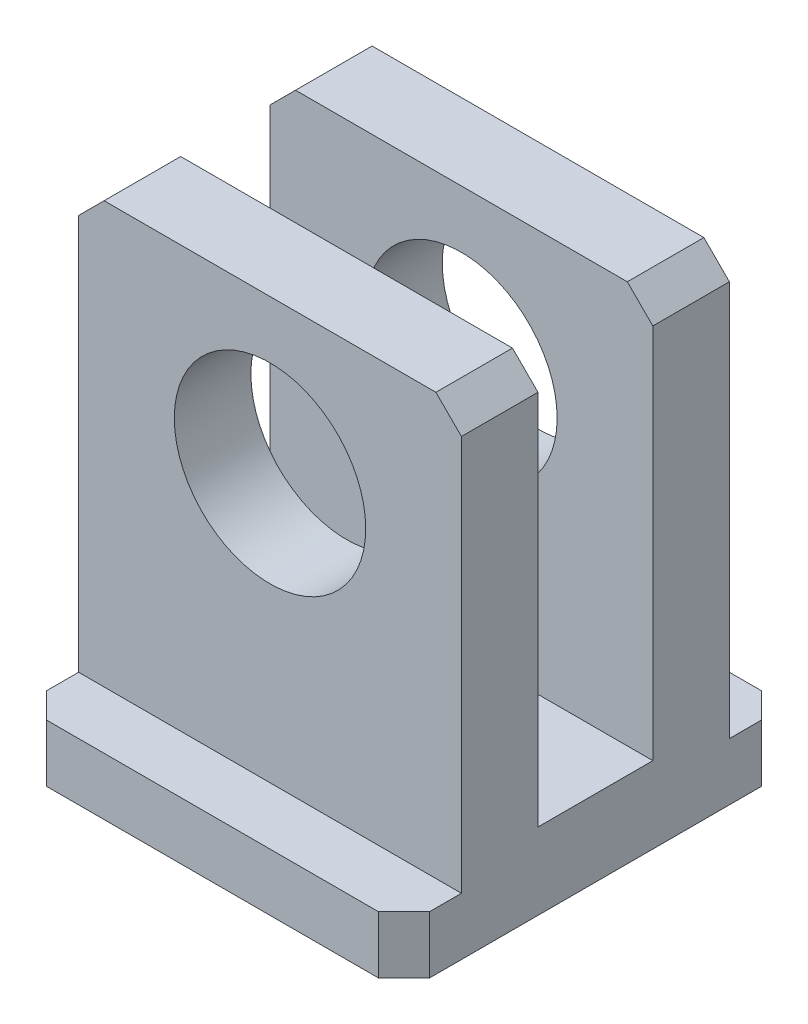
from build123d import *

# Parameters (mm, degrees)
EXTRUDE_1_DEPTH            = 6
SKETCH_8_W                 = 30
SKETCH_8_H                 = 4.5
EXTRUDE_4_DEPTH            = 4.5
CHAMFER_1_SIZE             = 2
CHAMFER_2_SIZE             = 2
CUT_EXTRUDE_2_REACH        = 26.75
SKETCH_8_5_R               = 7.5
SKETCH_13_W                = 30
SKETCH_13_H                = 6
EXTRUDE_5_DEPTH            = 4.5
CHAMFER_1_OF_MIRROR_4_SIZE = 2
CHAMFER_2_OF_MIRROR_4_SIZE = 2


with BuildPart() as part:
    # 草图1 → 凸台-拉伸1 (new body)
    with BuildSketch(Plane.XY):
        Polygon((-13, 18.75), (-15, 16.75), (-15, -18.75), (15, -18.75), (15, 16.75), (13, 18.75), align=None)
    extrude_1 = extrude(amount=EXTRUDE_1_DEPTH)

    # 草图8 → 凸台-拉伸4 (add)
    with BuildSketch(Plane.XY.offset(6)):
        with Locations((0, -16.5)):
            Rectangle(SKETCH_8_W, SKETCH_8_H)
    extrude_4 = extrude(amount=EXTRUDE_4_DEPTH)

    # 倒角1
    chamfer_1_edges = [part.edges().sort_by_distance(p)[0] for p in [
        (-15, -16.5, 10.5),
    ]]
    chamfer(chamfer_1_edges, length=CHAMFER_1_SIZE)

    # 倒角2
    chamfer_2_edges = [part.edges().sort_by_distance(p)[0] for p in [
        (15, -16.5, 10.5),
    ]]
    chamfer(chamfer_2_edges, length=CHAMFER_2_SIZE)

    # 草图8<5> → 切除-拉伸2 (cut, up to next)
    with BuildSketch(Plane.XY.offset(6), mode=Mode.PRIVATE) as cut_extrude_2_sk1:
        with Locations((0, 6.75)):
            Circle(SKETCH_8_5_R)
    cut_extrude_2_tool1 = extrude(cut_extrude_2_sk1.sketch, amount=-CUT_EXTRUDE_2_REACH, mode=Mode.PRIVATE) & part.part
    cut_extrude_2 = cut_extrude_2_tool1.solids().sort_by_distance((0, 6.75, 6))[0]
    add(cut_extrude_2, mode=Mode.SUBTRACT)

    # 草图13 → 凸台-拉伸5 (add)
    with BuildSketch(Plane(origin=(0, 0, 0), x_dir=(-1, 0, 0), z_dir=(0, 0, -1))):
        with Locations((0, -15.75)):
            Rectangle(SKETCH_13_W, SKETCH_13_H)
    extrude_5 = extrude(amount=EXTRUDE_5_DEPTH)

    # 镜向4: 凸台-拉伸1, 凸台-拉伸4, 切除-拉伸2, 凸台-拉伸5 across plane
    add(extrude_1.mirror(Plane(origin=(0, 0, -4.5), x_dir=(1, 0, 0), z_dir=(0, 0, -1))))
    add(extrude_4.mirror(Plane(origin=(0, 0, -4.5), x_dir=(1, 0, 0), z_dir=(0, 0, -1))))
    add(cut_extrude_2.mirror(Plane(origin=(0, 0, -4.5), x_dir=(1, 0, 0), z_dir=(0, 0, -1))), mode=Mode.SUBTRACT)
    add(extrude_5.mirror(Plane(origin=(0, 0, -4.5), x_dir=(1, 0, 0), z_dir=(0, 0, -1))))

    # 倒角1 of 镜向4
    chamfer_1_of_mirror_4_edges = [part.edges().sort_by_distance(p)[0] for p in [
        (-15, -16.5, -19.5),
    ]]
    chamfer(chamfer_1_of_mirror_4_edges, length=CHAMFER_1_OF_MIRROR_4_SIZE)

    # 倒角2 of 镜向4
    chamfer_2_of_mirror_4_edges = [part.edges().sort_by_distance(p)[0] for p in [
        (15, -16.5, -19.5),
    ]]
    chamfer(chamfer_2_of_mirror_4_edges, length=CHAMFER_2_OF_MIRROR_4_SIZE)


solid = part.part
